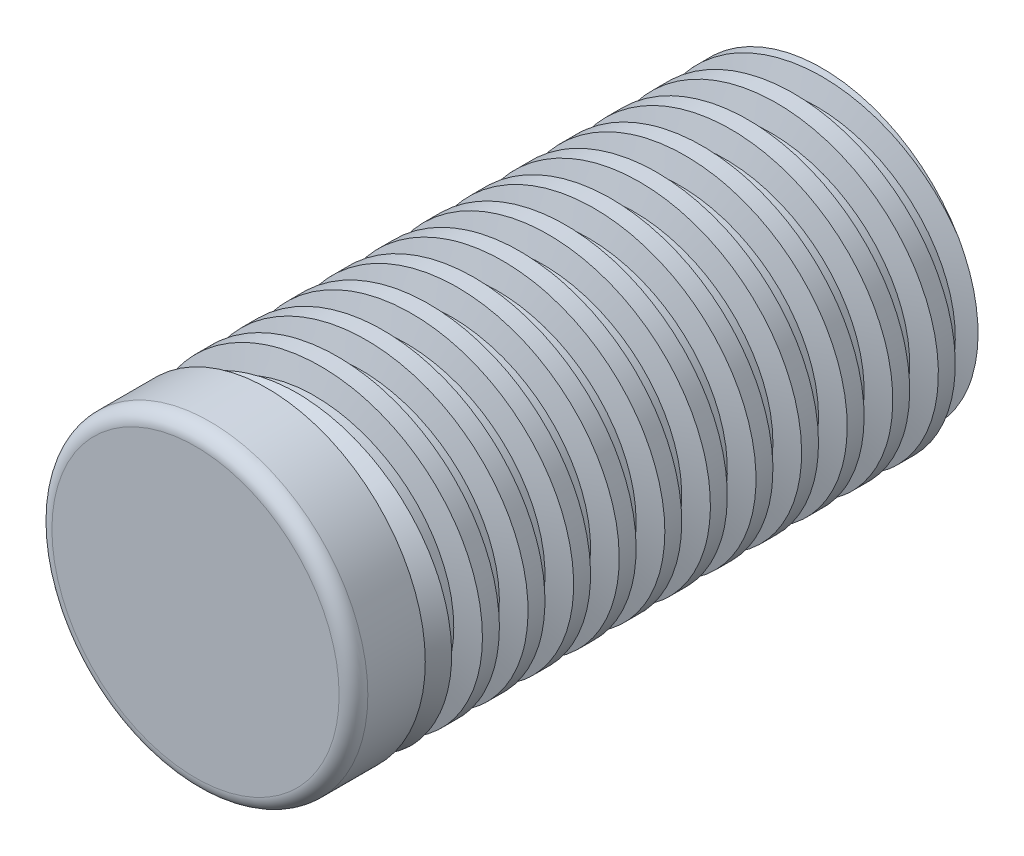
from build123d import *
from OCP.BRepFilletAPI import BRepFilletAPI_MakeChamfer

# Parameters (mm, degrees)
SKETCH1_R           = 11
BOSS_EXTRUDE1_DEPTH = 20
CHAMFER1_SIZE       = 2.38125
CHAMFER1_SIZE2      = 1.374815329
CUT_SWEEP1_PITCH    = 3.175
BOSS_EXTRUDE3_START = 5
SKETCH5_R           = 11
BOSS_EXTRUDE3_DEPTH = 5
FILLET1_R           = 1


with BuildPart() as part:
    # Sketch1 → Boss-Extrude1 (new, symmetric)
    with BuildSketch(Plane.XY):
        Circle(SKETCH1_R)
    extrude(amount=BOSS_EXTRUDE1_DEPTH, both=True)

    # Chamfer1: one chamfer whose edges measure the first distance from different faces: ONE call of the kernel's chamfer builder (chamfer() names one face for all edges)
    chamfer1_edges_1 = [part.edges().sort_by_distance(p)[0] for p in [
        (-11, 0, -20),
    ]]
    chamfer1_side_1 = [part.faces().sort_by_distance(p)[0] for p in [
        (0, 0, -20),
    ]]
    chamfer1_edges_2 = [part.edges().sort_by_distance(p)[0] for p in [
        (-11, 0, 20),
    ]]
    chamfer1_side_2 = [part.faces().sort_by_distance(p)[0] for p in [
        (-11, 0, 0),
    ]]
    chamfer1 = BRepFilletAPI_MakeChamfer(part.part.solid().wrapped)
    for e in chamfer1_edges_1:
        chamfer1.Add(CHAMFER1_SIZE, CHAMFER1_SIZE2, e.wrapped, chamfer1_side_1[0].wrapped)  # the first distance lies on this face
    for e in chamfer1_edges_2:
        chamfer1.Add(CHAMFER1_SIZE, CHAMFER1_SIZE2, e.wrapped, chamfer1_side_2[0].wrapped)  # the first distance lies on this face
    add(Compound.cast(chamfer1.Shape()), mode=Mode.REPLACE)

    # Cut-Sweep1: the profile of Sketch3 profile screwed along a right-hand helix of 13.598425 turns, 12 arcs to a turn; built about Z, then put on its axis
    cut_sweep1_z = Axis((0, 0, 0), (0, 0, 1))
    cut_sweep1_corners = [(11.0003, 0, 7.7585e-05), (9.41260794, 0, -0.4105275), (9.41260794, 0, -1.5875), (11.0003, 0, -1.998105085)]
    with BuildLine(mode=Mode.PRIVATE) as cut_sweep1_profile:
        Line(cut_sweep1_corners[0], cut_sweep1_corners[1])
        Line(cut_sweep1_corners[1], cut_sweep1_corners[2])
        Line(cut_sweep1_corners[2], cut_sweep1_corners[3])
        Line(cut_sweep1_corners[3], cut_sweep1_corners[0])
    cut_sweep1_cap = Face(cut_sweep1_profile.wire())
    cut_sweep1_turn_angles = [0, 15, 30, 45, 60, 75, 90, 105, 120, 135, 150, 165, 180, 195, 210, 225, 240, 255, 270, 285, 300, 315, 330, 345, 360]
    cut_sweep1_turn_weights = [1, 0.9659258262890683, 1, 0.9659258262890683, 1, 0.9659258262890683, 1, 0.9659258262890683, 1, 0.9659258262890683, 1, 0.9659258262890683, 1, 0.9659258262890683, 1, 0.9659258262890683, 1, 0.9659258262890683, 1, 0.9659258262890683, 1, 0.9659258262890683, 1, 0.9659258262890683, 1]
    cut_sweep1_turn_rails = [Edge.make_bspline([Vector(p[0], p[1], 0).rotate(cut_sweep1_z, cut_sweep1_turn_angles[k]) / cut_sweep1_turn_weights[k] + Vector(0, 0, p[2] + CUT_SWEEP1_PITCH * cut_sweep1_turn_angles[k] / 360) for k in range(25)], [0, 0, 0, 1, 1, 2, 2, 3, 3, 4, 4, 5, 5, 6, 6, 7, 7, 8, 8, 9, 9, 10, 10, 11, 11, 12, 12, 12], 2, cut_sweep1_turn_weights) for p in cut_sweep1_corners]
    cut_sweep1_turn_sides = [Face.make_surface_from_curves(cut_sweep1_turn_rails[p[0]], cut_sweep1_turn_rails[p[1]]) for p in [(0, 1), (1, 2), (2, 3), (3, 0)]]
    cut_sweep1_last_angles = [4680, 4695, 4710, 4725, 4740, 4755, 4770, 4785, 4800, 4815, 4830, 4845, 4860, 4875, 4890, 4892.716535433, 4895.433070866]
    cut_sweep1_last_weights = [1, 0.9659258262890683, 1, 0.9659258262890683, 1, 0.9659258262890683, 1, 0.9659258262890683, 1, 0.9659258262890683, 1, 0.9659258262890683, 1, 0.9659258262890683, 1, 0.9988762385483476, 1]
    cut_sweep1_last_rails = [Edge.make_bspline([Vector(p[0], p[1], 0).rotate(cut_sweep1_z, cut_sweep1_last_angles[k]) / cut_sweep1_last_weights[k] + Vector(0, 0, p[2] + CUT_SWEEP1_PITCH * cut_sweep1_last_angles[k] / 360) for k in range(17)], [0, 0, 0, 1, 1, 2, 2, 3, 3, 4, 4, 5, 5, 6, 6, 7, 7, 8, 8, 8], 2, cut_sweep1_last_weights) for p in cut_sweep1_corners]
    cut_sweep1_last_sides = [Face.make_surface_from_curves(cut_sweep1_last_rails[p[0]], cut_sweep1_last_rails[p[1]]) for p in [(0, 1), (1, 2), (2, 3), (3, 0)]]
    cut_sweep1 = Plane(origin=(0, 0, 20), x_dir=(0, 1, 0), z_dir=(0, 0, -1)) * Solid(Shell([*[p.moved(Location((0, 0, CUT_SWEEP1_PITCH * i))) for i in range(13) for p in cut_sweep1_turn_sides], *cut_sweep1_last_sides, cut_sweep1_cap, cut_sweep1_cap.rotate(cut_sweep1_z, 4895.433070866).moved(Location((0, 0, CUT_SWEEP1_PITCH * 4895.433070866 / 360)))]))
    add(cut_sweep1, mode=Mode.SUBTRACT)

    # Sketch5 → Boss-Extrude3 (add)
    with BuildSketch(Plane.XY.offset(20).offset(BOSS_EXTRUDE3_START)):
        Circle(SKETCH5_R)
    extrude(amount=-BOSS_EXTRUDE3_DEPTH)

    # Fillet1
    fillet1_edges = [part.edges().sort_by_distance(p)[0] for p in [
        (-11, 0, 25),
    ]]
    fillet(fillet1_edges, radius=FILLET1_R)


solid = part.part
